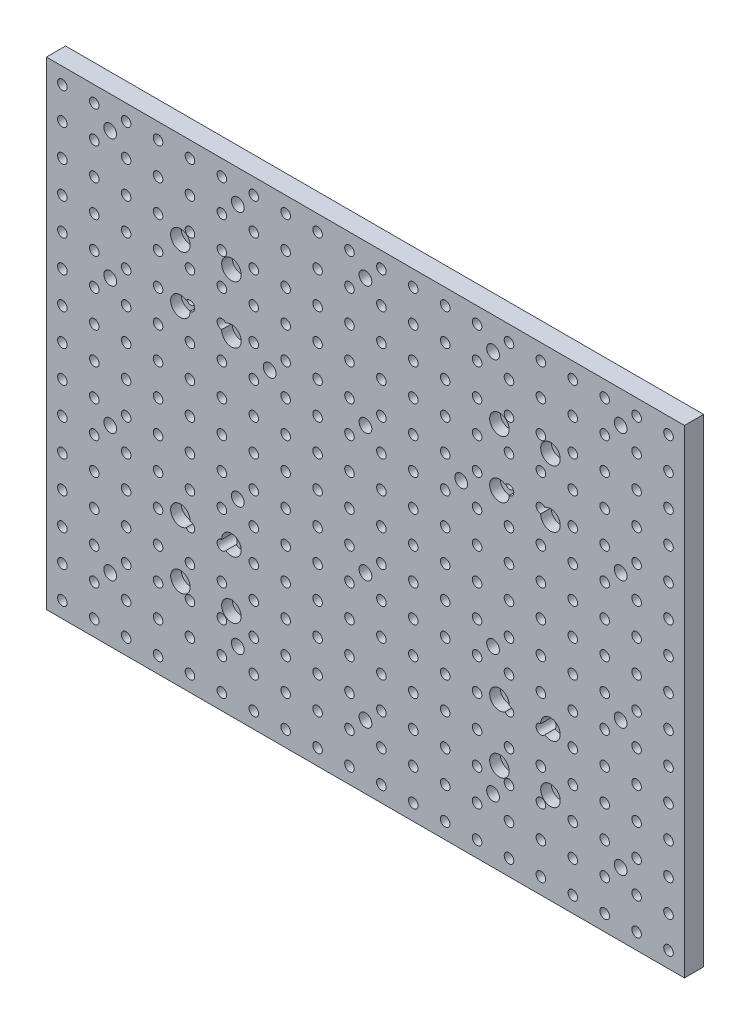
from build123d import *

# Parameters (mm, degrees)
SKETCH1_W                               = 400
SKETCH1_H                               = 300
BOSS_EXTRUDE1_DEPTH                     = 12
CBORE_FOR_M5_HEX_HEAD_BOLT1_D           = 5.5
CBORE_FOR_M5_HEX_HEAD_BOLT1_DEPTH       = 28.347633298
CBORE_FOR_M5_HEX_HEAD_BOLT1_CBORE_D     = 12.24
CBORE_FOR_M5_HEX_HEAD_BOLT1_CBORE_DEPTH = 6.58
CBORE_FOR_M5_HEX_HEAD_BOLT1_TIP         = 1.652366702
SKETCH5_R                               = 3
CUT_EXTRUDE1_DEPTH                      = 251.287834303
SKETCH6_R                               = 4
CUT_EXTRUDE2_DEPTH                      = 251.287834303


with BuildPart() as part:
    # Sketch1 → Boss-Extrude1 (new body)
    with BuildSketch(Plane.XY):
        Rectangle(SKETCH1_W, SKETCH1_H)
    extrude(amount=BOSS_EXTRUDE1_DEPTH)

    # CBORE for M5 Hex Head Bolt1
    with Locations(Plane(origin=(-116, 92.75, 12), x_dir=(1, 0, 0), z_dir=(0, 0, 1))):
        with Locations((0, 0), (32, 0), (0, -36), (32, -36), (0, -149.5), (32, -149.5), (0, -185.5), (32, -185.5), (232, -185.5), (200, -185.5), (200, -149.5), (232, -149.5), (200, 0), (232, 0), (200, -36), (232, -36)):
            CounterBoreHole(CBORE_FOR_M5_HEX_HEAD_BOLT1_D / 2, CBORE_FOR_M5_HEX_HEAD_BOLT1_CBORE_D / 2, CBORE_FOR_M5_HEX_HEAD_BOLT1_CBORE_DEPTH, depth=CBORE_FOR_M5_HEX_HEAD_BOLT1_DEPTH)
            with Locations((0, 0, -(CBORE_FOR_M5_HEX_HEAD_BOLT1_DEPTH + CBORE_FOR_M5_HEX_HEAD_BOLT1_TIP / 2))):  # 118° drill point
                Cone(0, CBORE_FOR_M5_HEX_HEAD_BOLT1_D / 2, CBORE_FOR_M5_HEX_HEAD_BOLT1_TIP, mode=Mode.SUBTRACT)

    # Sketch5 → Cut-Extrude1 (cut, through all)
    with BuildSketch(Plane.XY.offset(12)):
        with Locations((-190, 140)):
            Circle(SKETCH5_R)
        with Locations((-170, 140)):
            Circle(SKETCH5_R)
        with Locations((-150, 140)):
            Circle(SKETCH5_R)
        with Locations((-130, 140)):
            Circle(SKETCH5_R)
        with Locations((-110, 140)):
            Circle(SKETCH5_R)
        with Locations((-90, 140)):
            Circle(SKETCH5_R)
        with Locations((-70, 140)):
            Circle(SKETCH5_R)
        with Locations((-50, 140)):
            Circle(SKETCH5_R)
        with Locations((-30, 140)):
            Circle(SKETCH5_R)
        with Locations((-10, 140)):
            Circle(SKETCH5_R)
        with Locations((10, 140)):
            Circle(SKETCH5_R)
        with Locations((30, 140)):
            Circle(SKETCH5_R)
        with Locations((50, 140)):
            Circle(SKETCH5_R)
        with Locations((70, 140)):
            Circle(SKETCH5_R)
        with Locations((90, 140)):
            Circle(SKETCH5_R)
        with Locations((110, 140)):
            Circle(SKETCH5_R)
        with Locations((130, 140)):
            Circle(SKETCH5_R)
        with Locations((150, 140)):
            Circle(SKETCH5_R)
        with Locations((170, 140)):
            Circle(SKETCH5_R)
        with Locations((190, 140)):
            Circle(SKETCH5_R)
        with Locations((-170, 120)):
            Circle(SKETCH5_R)
        with Locations((-150, 120)):
            Circle(SKETCH5_R)
        with Locations((-130, 120)):
            Circle(SKETCH5_R)
        with Locations((-110, 120)):
            Circle(SKETCH5_R)
        with Locations((-90, 120)):
            Circle(SKETCH5_R)
        with Locations((-70, 120)):
            Circle(SKETCH5_R)
        with Locations((-50, 120)):
            Circle(SKETCH5_R)
        with Locations((-30, 120)):
            Circle(SKETCH5_R)
        with Locations((-10, 120)):
            Circle(SKETCH5_R)
        with Locations((10, 120)):
            Circle(SKETCH5_R)
        with Locations((30, 120)):
            Circle(SKETCH5_R)
        with Locations((50, 120)):
            Circle(SKETCH5_R)
        with Locations((70, 120)):
            Circle(SKETCH5_R)
        with Locations((90, 120)):
            Circle(SKETCH5_R)
        with Locations((110, 120)):
            Circle(SKETCH5_R)
        with Locations((130, 120)):
            Circle(SKETCH5_R)
        with Locations((150, 120)):
            Circle(SKETCH5_R)
        with Locations((170, 120)):
            Circle(SKETCH5_R)
        with Locations((190, 120)):
            Circle(SKETCH5_R)
        with Locations((-170, 100)):
            Circle(SKETCH5_R)
        with Locations((-150, 100)):
            Circle(SKETCH5_R)
        with Locations((-130, 100)):
            Circle(SKETCH5_R)
        with Locations((-110, 100)):
            Circle(SKETCH5_R)
        with Locations((-90, 100)):
            Circle(SKETCH5_R)
        with Locations((-70, 100)):
            Circle(SKETCH5_R)
        with Locations((-50, 100)):
            Circle(SKETCH5_R)
        with Locations((-30, 100)):
            Circle(SKETCH5_R)
        with Locations((-10, 100)):
            Circle(SKETCH5_R)
        with Locations((10, 100)):
            Circle(SKETCH5_R)
        with Locations((30, 100)):
            Circle(SKETCH5_R)
        with Locations((50, 100)):
            Circle(SKETCH5_R)
        with Locations((70, 100)):
            Circle(SKETCH5_R)
        with Locations((90, 100)):
            Circle(SKETCH5_R)
        with Locations((110, 100)):
            Circle(SKETCH5_R)
        with Locations((130, 100)):
            Circle(SKETCH5_R)
        with Locations((150, 100)):
            Circle(SKETCH5_R)
        with Locations((170, 100)):
            Circle(SKETCH5_R)
        with Locations((190, 100)):
            Circle(SKETCH5_R)
        with Locations((-170, 80)):
            Circle(SKETCH5_R)
        with Locations((-150, 80)):
            Circle(SKETCH5_R)
        with Locations((-130, 80)):
            Circle(SKETCH5_R)
        with Locations((-110, 80)):
            Circle(SKETCH5_R)
        with Locations((-90, 80)):
            Circle(SKETCH5_R)
        with Locations((-70, 80)):
            Circle(SKETCH5_R)
        with Locations((-50, 80)):
            Circle(SKETCH5_R)
        with Locations((-30, 80)):
            Circle(SKETCH5_R)
        with Locations((-10, 80)):
            Circle(SKETCH5_R)
        with Locations((10, 80)):
            Circle(SKETCH5_R)
        with Locations((30, 80)):
            Circle(SKETCH5_R)
        with Locations((50, 80)):
            Circle(SKETCH5_R)
        with Locations((70, 80)):
            Circle(SKETCH5_R)
        with Locations((90, 80)):
            Circle(SKETCH5_R)
        with Locations((110, 80)):
            Circle(SKETCH5_R)
        with Locations((130, 80)):
            Circle(SKETCH5_R)
        with Locations((150, 80)):
            Circle(SKETCH5_R)
        with Locations((170, 80)):
            Circle(SKETCH5_R)
        with Locations((190, 80)):
            Circle(SKETCH5_R)
        with Locations((-170, 60)):
            Circle(SKETCH5_R)
        with Locations((-150, 60)):
            Circle(SKETCH5_R)
        with Locations((-130, 60)):
            Circle(SKETCH5_R)
        with Locations((-110, 60)):
            Circle(SKETCH5_R)
        with Locations((-90, 60)):
            Circle(SKETCH5_R)
        with Locations((-70, 60)):
            Circle(SKETCH5_R)
        with Locations((-50, 60)):
            Circle(SKETCH5_R)
        with Locations((-30, 60)):
            Circle(SKETCH5_R)
        with Locations((-10, 60)):
            Circle(SKETCH5_R)
        with Locations((10, 60)):
            Circle(SKETCH5_R)
        with Locations((30, 60)):
            Circle(SKETCH5_R)
        with Locations((50, 60)):
            Circle(SKETCH5_R)
        with Locations((70, 60)):
            Circle(SKETCH5_R)
        with Locations((90, 60)):
            Circle(SKETCH5_R)
        with Locations((110, 60)):
            Circle(SKETCH5_R)
        with Locations((130, 60)):
            Circle(SKETCH5_R)
        with Locations((150, 60)):
            Circle(SKETCH5_R)
        with Locations((170, 60)):
            Circle(SKETCH5_R)
        with Locations((190, 60)):
            Circle(SKETCH5_R)
        with Locations((-170, 40)):
            Circle(SKETCH5_R)
        with Locations((-150, 40)):
            Circle(SKETCH5_R)
        with Locations((-130, 40)):
            Circle(SKETCH5_R)
        with Locations((-110, 40)):
            Circle(SKETCH5_R)
        with Locations((-90, 40)):
            Circle(SKETCH5_R)
        with Locations((-70, 40)):
            Circle(SKETCH5_R)
        with Locations((-50, 40)):
            Circle(SKETCH5_R)
        with Locations((-30, 40)):
            Circle(SKETCH5_R)
        with Locations((-10, 40)):
            Circle(SKETCH5_R)
        with Locations((10, 40)):
            Circle(SKETCH5_R)
        with Locations((30, 40)):
            Circle(SKETCH5_R)
        with Locations((50, 40)):
            Circle(SKETCH5_R)
        with Locations((70, 40)):
            Circle(SKETCH5_R)
        with Locations((90, 40)):
            Circle(SKETCH5_R)
        with Locations((110, 40)):
            Circle(SKETCH5_R)
        with Locations((130, 40)):
            Circle(SKETCH5_R)
        with Locations((150, 40)):
            Circle(SKETCH5_R)
        with Locations((170, 40)):
            Circle(SKETCH5_R)
        with Locations((190, 40)):
            Circle(SKETCH5_R)
        with Locations((-170, 20)):
            Circle(SKETCH5_R)
        with Locations((-150, 20)):
            Circle(SKETCH5_R)
        with Locations((-130, 20)):
            Circle(SKETCH5_R)
        with Locations((-110, 20)):
            Circle(SKETCH5_R)
        with Locations((-90, 20)):
            Circle(SKETCH5_R)
        with Locations((-70, 20)):
            Circle(SKETCH5_R)
        with Locations((-50, 20)):
            Circle(SKETCH5_R)
        with Locations((-30, 20)):
            Circle(SKETCH5_R)
        with Locations((-10, 20)):
            Circle(SKETCH5_R)
        with Locations((10, 20)):
            Circle(SKETCH5_R)
        with Locations((30, 20)):
            Circle(SKETCH5_R)
        with Locations((50, 20)):
            Circle(SKETCH5_R)
        with Locations((70, 20)):
            Circle(SKETCH5_R)
        with Locations((90, 20)):
            Circle(SKETCH5_R)
        with Locations((110, 20)):
            Circle(SKETCH5_R)
        with Locations((130, 20)):
            Circle(SKETCH5_R)
        with Locations((150, 20)):
            Circle(SKETCH5_R)
        with Locations((170, 20)):
            Circle(SKETCH5_R)
        with Locations((190, 20)):
            Circle(SKETCH5_R)
        with Locations((-170, 0)):
            Circle(SKETCH5_R)
        with Locations((-150, 0)):
            Circle(SKETCH5_R)
        with Locations((-130, 0)):
            Circle(SKETCH5_R)
        with Locations((-110, 0)):
            Circle(SKETCH5_R)
        with Locations((-90, 0)):
            Circle(SKETCH5_R)
        with Locations((-70, 0)):
            Circle(SKETCH5_R)
        with Locations((-50, 0)):
            Circle(SKETCH5_R)
        with Locations((-30, 0)):
            Circle(SKETCH5_R)
        with Locations((-10, 0)):
            Circle(SKETCH5_R)
        with Locations((10, 0)):
            Circle(SKETCH5_R)
        with Locations((30, 0)):
            Circle(SKETCH5_R)
        with Locations((50, 0)):
            Circle(SKETCH5_R)
        with Locations((70, 0)):
            Circle(SKETCH5_R)
        with Locations((90, 0)):
            Circle(SKETCH5_R)
        with Locations((110, 0)):
            Circle(SKETCH5_R)
        with Locations((130, 0)):
            Circle(SKETCH5_R)
        with Locations((150, 0)):
            Circle(SKETCH5_R)
        with Locations((170, 0)):
            Circle(SKETCH5_R)
        with Locations((190, 0)):
            Circle(SKETCH5_R)
        with Locations((-170, -20)):
            Circle(SKETCH5_R)
        with Locations((-150, -20)):
            Circle(SKETCH5_R)
        with Locations((-130, -20)):
            Circle(SKETCH5_R)
        with Locations((-110, -20)):
            Circle(SKETCH5_R)
        with Locations((-90, -20)):
            Circle(SKETCH5_R)
        with Locations((-70, -20)):
            Circle(SKETCH5_R)
        with Locations((-50, -20)):
            Circle(SKETCH5_R)
        with Locations((-30, -20)):
            Circle(SKETCH5_R)
        with Locations((-10, -20)):
            Circle(SKETCH5_R)
        with Locations((10, -20)):
            Circle(SKETCH5_R)
        with Locations((30, -20)):
            Circle(SKETCH5_R)
        with Locations((50, -20)):
            Circle(SKETCH5_R)
        with Locations((70, -20)):
            Circle(SKETCH5_R)
        with Locations((90, -20)):
            Circle(SKETCH5_R)
        with Locations((110, -20)):
            Circle(SKETCH5_R)
        with Locations((130, -20)):
            Circle(SKETCH5_R)
        with Locations((150, -20)):
            Circle(SKETCH5_R)
        with Locations((170, -20)):
            Circle(SKETCH5_R)
        with Locations((190, -20)):
            Circle(SKETCH5_R)
        with Locations((-170, -40)):
            Circle(SKETCH5_R)
        with Locations((-150, -40)):
            Circle(SKETCH5_R)
        with Locations((-130, -40)):
            Circle(SKETCH5_R)
        with Locations((-110, -40)):
            Circle(SKETCH5_R)
        with Locations((-90, -40)):
            Circle(SKETCH5_R)
        with Locations((-70, -40)):
            Circle(SKETCH5_R)
        with Locations((-50, -40)):
            Circle(SKETCH5_R)
        with Locations((-30, -40)):
            Circle(SKETCH5_R)
        with Locations((-10, -40)):
            Circle(SKETCH5_R)
        with Locations((10, -40)):
            Circle(SKETCH5_R)
        with Locations((30, -40)):
            Circle(SKETCH5_R)
        with Locations((50, -40)):
            Circle(SKETCH5_R)
        with Locations((70, -40)):
            Circle(SKETCH5_R)
        with Locations((90, -40)):
            Circle(SKETCH5_R)
        with Locations((110, -40)):
            Circle(SKETCH5_R)
        with Locations((130, -40)):
            Circle(SKETCH5_R)
        with Locations((150, -40)):
            Circle(SKETCH5_R)
        with Locations((170, -40)):
            Circle(SKETCH5_R)
        with Locations((190, -40)):
            Circle(SKETCH5_R)
        with Locations((-170, -60)):
            Circle(SKETCH5_R)
        with Locations((-150, -60)):
            Circle(SKETCH5_R)
        with Locations((-130, -60)):
            Circle(SKETCH5_R)
        with Locations((-110, -60)):
            Circle(SKETCH5_R)
        with Locations((-90, -60)):
            Circle(SKETCH5_R)
        with Locations((-70, -60)):
            Circle(SKETCH5_R)
        with Locations((-50, -60)):
            Circle(SKETCH5_R)
        with Locations((-30, -60)):
            Circle(SKETCH5_R)
        with Locations((-10, -60)):
            Circle(SKETCH5_R)
        with Locations((10, -60)):
            Circle(SKETCH5_R)
        with Locations((30, -60)):
            Circle(SKETCH5_R)
        with Locations((50, -60)):
            Circle(SKETCH5_R)
        with Locations((70, -60)):
            Circle(SKETCH5_R)
        with Locations((90, -60)):
            Circle(SKETCH5_R)
        with Locations((110, -60)):
            Circle(SKETCH5_R)
        with Locations((130, -60)):
            Circle(SKETCH5_R)
        with Locations((150, -60)):
            Circle(SKETCH5_R)
        with Locations((170, -60)):
            Circle(SKETCH5_R)
        with Locations((190, -60)):
            Circle(SKETCH5_R)
        with Locations((-170, -80)):
            Circle(SKETCH5_R)
        with Locations((-150, -80)):
            Circle(SKETCH5_R)
        with Locations((-130, -80)):
            Circle(SKETCH5_R)
        with Locations((-110, -80)):
            Circle(SKETCH5_R)
        with Locations((-90, -80)):
            Circle(SKETCH5_R)
        with Locations((-70, -80)):
            Circle(SKETCH5_R)
        with Locations((-50, -80)):
            Circle(SKETCH5_R)
        with Locations((-30, -80)):
            Circle(SKETCH5_R)
        with Locations((-10, -80)):
            Circle(SKETCH5_R)
        with Locations((10, -80)):
            Circle(SKETCH5_R)
        with Locations((30, -80)):
            Circle(SKETCH5_R)
        with Locations((50, -80)):
            Circle(SKETCH5_R)
        with Locations((70, -80)):
            Circle(SKETCH5_R)
        with Locations((90, -80)):
            Circle(SKETCH5_R)
        with Locations((110, -80)):
            Circle(SKETCH5_R)
        with Locations((130, -80)):
            Circle(SKETCH5_R)
        with Locations((150, -80)):
            Circle(SKETCH5_R)
        with Locations((170, -80)):
            Circle(SKETCH5_R)
        with Locations((190, -80)):
            Circle(SKETCH5_R)
        with Locations((-170, -100)):
            Circle(SKETCH5_R)
        with Locations((-150, -100)):
            Circle(SKETCH5_R)
        with Locations((-130, -100)):
            Circle(SKETCH5_R)
        with Locations((-110, -100)):
            Circle(SKETCH5_R)
        with Locations((-90, -100)):
            Circle(SKETCH5_R)
        with Locations((-70, -100)):
            Circle(SKETCH5_R)
        with Locations((-50, -100)):
            Circle(SKETCH5_R)
        with Locations((-30, -100)):
            Circle(SKETCH5_R)
        with Locations((-10, -100)):
            Circle(SKETCH5_R)
        with Locations((10, -100)):
            Circle(SKETCH5_R)
        with Locations((30, -100)):
            Circle(SKETCH5_R)
        with Locations((50, -100)):
            Circle(SKETCH5_R)
        with Locations((70, -100)):
            Circle(SKETCH5_R)
        with Locations((90, -100)):
            Circle(SKETCH5_R)
        with Locations((110, -100)):
            Circle(SKETCH5_R)
        with Locations((130, -100)):
            Circle(SKETCH5_R)
        with Locations((150, -100)):
            Circle(SKETCH5_R)
        with Locations((170, -100)):
            Circle(SKETCH5_R)
        with Locations((190, -100)):
            Circle(SKETCH5_R)
        with Locations((-170, -120)):
            Circle(SKETCH5_R)
        with Locations((-150, -120)):
            Circle(SKETCH5_R)
        with Locations((-130, -120)):
            Circle(SKETCH5_R)
        with Locations((-110, -120)):
            Circle(SKETCH5_R)
        with Locations((-90, -120)):
            Circle(SKETCH5_R)
        with Locations((-70, -120)):
            Circle(SKETCH5_R)
        with Locations((-50, -120)):
            Circle(SKETCH5_R)
        with Locations((-30, -120)):
            Circle(SKETCH5_R)
        with Locations((-10, -120)):
            Circle(SKETCH5_R)
        with Locations((10, -120)):
            Circle(SKETCH5_R)
        with Locations((30, -120)):
            Circle(SKETCH5_R)
        with Locations((50, -120)):
            Circle(SKETCH5_R)
        with Locations((70, -120)):
            Circle(SKETCH5_R)
        with Locations((90, -120)):
            Circle(SKETCH5_R)
        with Locations((110, -120)):
            Circle(SKETCH5_R)
        with Locations((130, -120)):
            Circle(SKETCH5_R)
        with Locations((150, -120)):
            Circle(SKETCH5_R)
        with Locations((170, -120)):
            Circle(SKETCH5_R)
        with Locations((190, -120)):
            Circle(SKETCH5_R)
        with Locations((-170, -140)):
            Circle(SKETCH5_R)
        with Locations((-150, -140)):
            Circle(SKETCH5_R)
        with Locations((-130, -140)):
            Circle(SKETCH5_R)
        with Locations((-110, -140)):
            Circle(SKETCH5_R)
        with Locations((-90, -140)):
            Circle(SKETCH5_R)
        with Locations((-70, -140)):
            Circle(SKETCH5_R)
        with Locations((-50, -140)):
            Circle(SKETCH5_R)
        with Locations((-30, -140)):
            Circle(SKETCH5_R)
        with Locations((-10, -140)):
            Circle(SKETCH5_R)
        with Locations((10, -140)):
            Circle(SKETCH5_R)
        with Locations((30, -140)):
            Circle(SKETCH5_R)
        with Locations((50, -140)):
            Circle(SKETCH5_R)
        with Locations((70, -140)):
            Circle(SKETCH5_R)
        with Locations((90, -140)):
            Circle(SKETCH5_R)
        with Locations((110, -140)):
            Circle(SKETCH5_R)
        with Locations((130, -140)):
            Circle(SKETCH5_R)
        with Locations((150, -140)):
            Circle(SKETCH5_R)
        with Locations((170, -140)):
            Circle(SKETCH5_R)
        with Locations((190, -140)):
            Circle(SKETCH5_R)
        with Locations((-190, 120)):
            Circle(SKETCH5_R)
        with Locations((-190, 100)):
            Circle(SKETCH5_R)
        with Locations((-190, 80)):
            Circle(SKETCH5_R)
        with Locations((-190, 60)):
            Circle(SKETCH5_R)
        with Locations((-190, 40)):
            Circle(SKETCH5_R)
        with Locations((-190, 20)):
            Circle(SKETCH5_R)
        with Locations((-190, 0)):
            Circle(SKETCH5_R)
        with Locations((-190, -20)):
            Circle(SKETCH5_R)
        with Locations((-190, -40)):
            Circle(SKETCH5_R)
        with Locations((-190, -60)):
            Circle(SKETCH5_R)
        with Locations((-190, -80)):
            Circle(SKETCH5_R)
        with Locations((-190, -100)):
            Circle(SKETCH5_R)
        with Locations((-190, -120)):
            Circle(SKETCH5_R)
        with Locations((-190, -140)):
            Circle(SKETCH5_R)
    extrude(amount=-CUT_EXTRUDE1_DEPTH, mode=Mode.SUBTRACT)

    # Sketch6 → Cut-Extrude2 (cut, through all)
    with BuildSketch(Plane.XY.offset(12)):
        with Locations((-160, 130)):
            Circle(SKETCH6_R)
        with Locations((-80, 130)):
            Circle(SKETCH6_R)
        with Locations((0, 130)):
            Circle(SKETCH6_R)
        with Locations((80, 130)):
            Circle(SKETCH6_R)
        with Locations((160, 130)):
            Circle(SKETCH6_R)
        with Locations((-160, 50)):
            Circle(SKETCH6_R)
        with Locations((0, 50)):
            Circle(SKETCH6_R)
        with Locations((160, 50)):
            Circle(SKETCH6_R)
        with Locations((-160, -30)):
            Circle(SKETCH6_R)
        with Locations((-80, -30)):
            Circle(SKETCH6_R)
        with Locations((0, -30)):
            Circle(SKETCH6_R)
        with Locations((80, -30)):
            Circle(SKETCH6_R)
        with Locations((160, -30)):
            Circle(SKETCH6_R)
        with Locations((-160, -110)):
            Circle(SKETCH6_R)
        with Locations((-80, -110)):
            Circle(SKETCH6_R)
        with Locations((0, -110)):
            Circle(SKETCH6_R)
        with Locations((80, -110)):
            Circle(SKETCH6_R)
        with Locations((160, -110)):
            Circle(SKETCH6_R)
        with Locations((-60, 50)):
            Circle(SKETCH6_R)
        with Locations((60, 50)):
            Circle(SKETCH6_R)
    extrude(amount=-CUT_EXTRUDE2_DEPTH, mode=Mode.SUBTRACT)


solid = part.part
